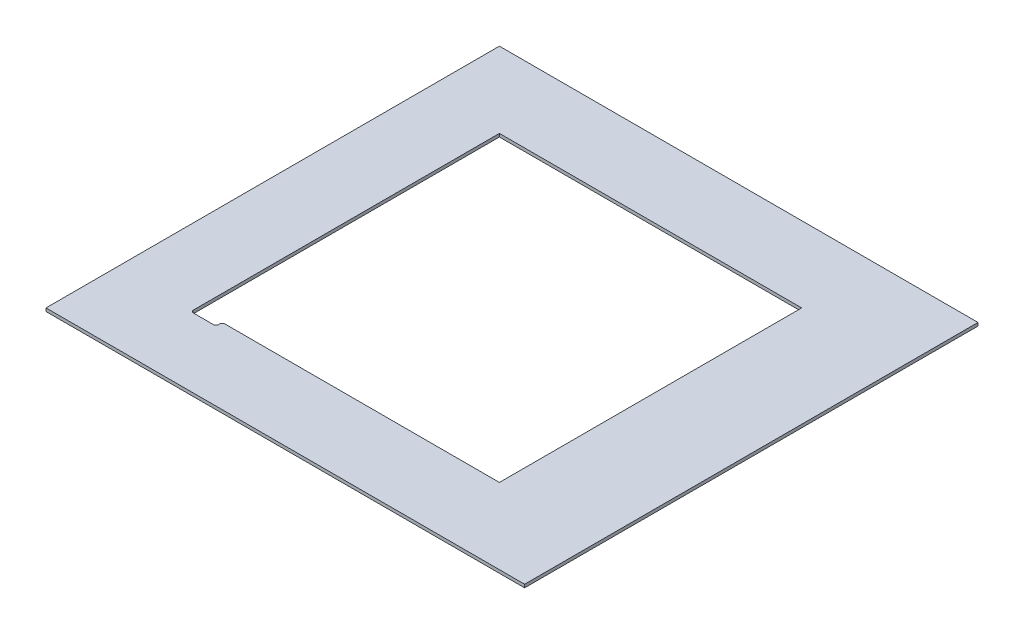
from build123d import *

# Parameters (mm, degrees)
SKETCH1_W           = 482.6
SKETCH1_H           = 457.2
BOSS_EXTRUDE1_DEPTH = 3.175
FILLET1_R           = 2.54


with BuildPart() as part:
    # Sketch1 → Boss-Extrude1 (new body)
    with BuildSketch(Plane(origin=(0, 0, 0), x_dir=(1, 0, 0), z_dir=(0, 1, 0))):
        with Locations((-1.251503591, 0)):
            Rectangle(SKETCH1_W, SKETCH1_H)
        Polygon((-166.351503591, -152.4), (-166.351503591, 152.4), (138.448496409, 152.4), (138.448496409, -152.4), (-140.951503591, -152.4), (-140.951503591, -158.75), (-166.351503591, -158.75), align=None, mode=Mode.SUBTRACT)
    extrude(amount=BOSS_EXTRUDE1_DEPTH)

    # Fillet1
    fillet1_edges = [part.edges().sort_by_distance(p)[0] for p in [
        (-140.951503591, 1.5875, 158.75),
        (-166.351503591, 1.5875, 158.75),
        (-140.951503591, 1.5875, 152.4),
    ]]
    fillet(fillet1_edges, radius=FILLET1_R)


solid = part.part
